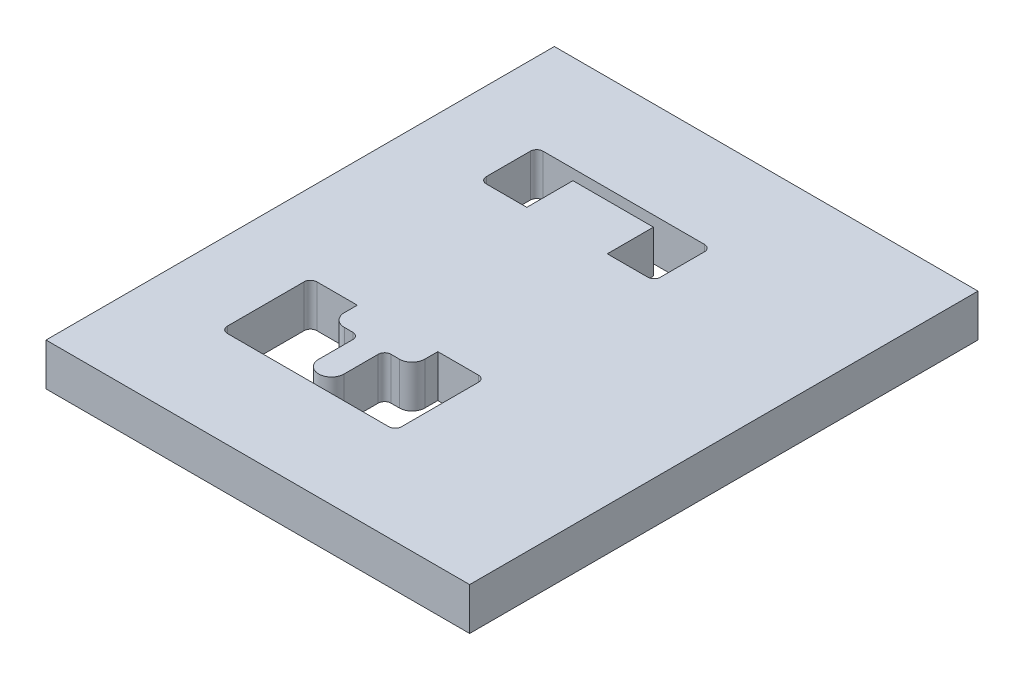
from build123d import *

# Parameters (mm, degrees)
SKETCH1_W           = 200
SKETCH1_H           = 240
BOSS_EXTRUDE1_DEPTH = 20
CUT_EXTRUDE3_REACH  = 159.48
CUT_EXTRUDE4_REACH  = 159.48


with BuildPart() as part:
    # Sketch1 → Boss-Extrude1 (new body)
    with BuildSketch(Plane(origin=(0, 0, 0), x_dir=(1, 0, 0), z_dir=(0, 1, 0))):
        Rectangle(SKETCH1_W, SKETCH1_H)
    extrude(amount=-BOSS_EXTRUDE1_DEPTH)

    # Sketch5 → Cut-Extrude3 (cut, up to next)
    with BuildSketch(Plane(origin=(0, 0, 0), x_dir=(1, 0, 0), z_dir=(0, 1, 0)), mode=Mode.PRIVATE) as cut_extrude3_sk1:
        with BuildLine():
            Line((-62.87, -35.27), (-62.87, -71.53))
            ThreePointArc((-62.87, -71.53), (-61.991320344, -73.651320344), (-59.87, -74.53))
            Line((-59.87, -74.53), (16.37, -74.53))
            ThreePointArc((16.37, -74.53), (18.491320344, -73.651320344), (19.37, -71.53))
            Line((19.37, -71.53), (19.37, -35.27))
            ThreePointArc((19.37, -35.27), (18.491320344, -33.148679656), (16.37, -32.27))
            Line((16.37, -32.27), (-2.75, -32.27))
            Line((-2.75, -32.27), (-2.75, -38.4))
            ThreePointArc((-2.75, -38.4), (-4.507359313, -42.642640687), (-8.75, -44.4))
            Line((-8.75, -44.4), (-12.75, -44.4))
            ThreePointArc((-12.75, -44.4), (-14.871320344, -45.278679656), (-15.75, -47.4))
            Line((-15.75, -47.4), (-15.75, -63.53))
            ThreePointArc((-15.75, -63.53), (-21.75, -69.53), (-27.75, -63.53))
            Line((-27.75, -63.53), (-27.75, -47.4))
            ThreePointArc((-27.75, -47.4), (-28.628679656, -45.278679656), (-30.75, -44.4))
            Line((-30.75, -44.4), (-34.75, -44.4))
            ThreePointArc((-34.75, -44.4), (-38.992640687, -42.642640687), (-40.75, -38.4))
            Line((-40.75, -38.4), (-40.75, -32.27))
            Line((-40.75, -32.27), (-59.87, -32.27))
            ThreePointArc((-59.87, -32.27), (-61.991320344, -33.148679656), (-62.87, -35.27))
        make_face()
    cut_extrude3_tool1 = extrude(cut_extrude3_sk1.sketch, amount=-CUT_EXTRUDE3_REACH, mode=Mode.PRIVATE) & part.part
    add(cut_extrude3_tool1.solids().sort_by_distance((-39.64645, 0, 43.29645))[0], mode=Mode.SUBTRACT)

    # Sketch6 → Cut-Extrude4 (cut, up to next)
    with BuildSketch(Plane(origin=(0, 0, 0), x_dir=(1, 0, 0), z_dir=(0, 1, 0)), mode=Mode.PRIVATE) as cut_extrude4_sk1:
        with BuildLine():
            Line((-62.87, 50.73), (-62.87, 71.53))
            ThreePointArc((-62.87, 71.53), (-61.991320344, 73.651320344), (-59.87, 74.53))
            Line((-59.87, 74.53), (16.37, 74.53))
            ThreePointArc((16.37, 74.53), (18.491320344, 73.651320344), (19.37, 71.53))
            Line((19.37, 71.53), (19.37, 50.73))
            ThreePointArc((19.37, 50.73), (18.491320344, 48.608679656), (16.37, 47.73))
            Line((16.37, 47.73), (-2.75, 47.73))
            Line((-2.75, 47.73), (-2.75, 69.53))
            Line((-2.75, 69.53), (-40.75, 69.53))
            Line((-40.75, 69.53), (-40.75, 47.73))
            Line((-40.75, 47.73), (-59.87, 47.73))
            ThreePointArc((-59.87, 47.73), (-61.991320344, 48.608679656), (-62.87, 50.73))
        make_face()
    cut_extrude4_tool1 = extrude(cut_extrude4_sk1.sketch, amount=-CUT_EXTRUDE4_REACH, mode=Mode.PRIVATE) & part.part
    add(cut_extrude4_tool1.solids().sort_by_distance((-62.005034, 0, -61.13))[0], mode=Mode.SUBTRACT)


solid = part.part
